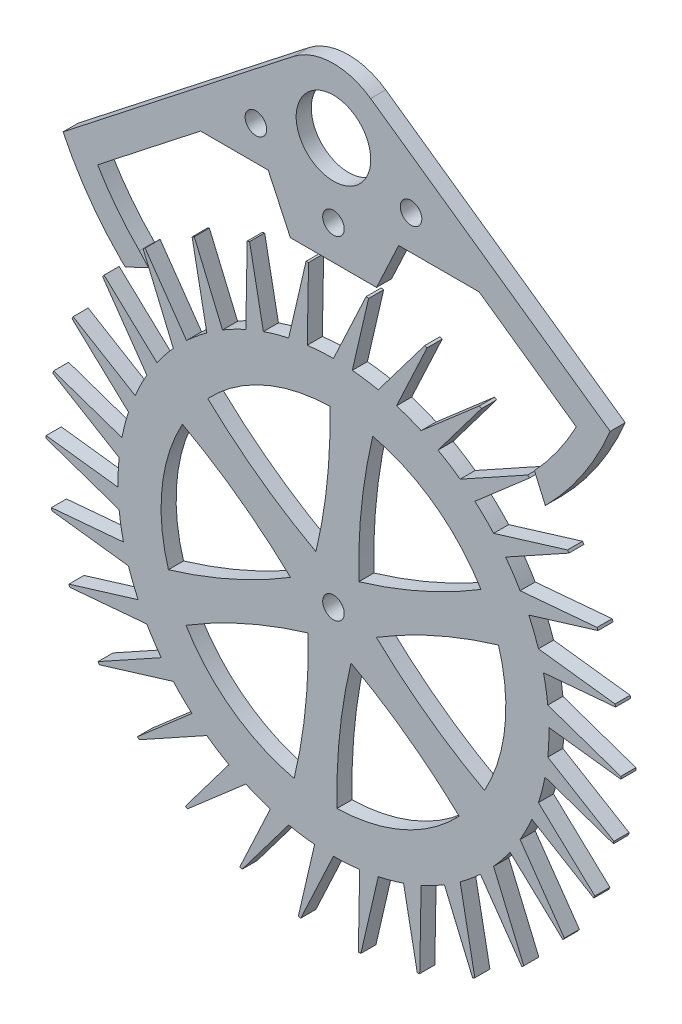
from build123d import *

# Parameters (mm, degrees)
BOSS_EXTRUDE1_OUTLINE_R   = 10.9855
BOSS_EXTRUDE1_DEPTH       = 4.445
BOSS_EXTRUDE1_2_OUTLINE_R = 3.175
BOSS_EXTRUDE1_2_DEPTH     = 4.445
BOSS_EXTRUDE2_START       = -4.445
BOSS_EXTRUDE2_DEPTH       = 4.445
SKETCH7_R                 = 3.175
CUT_EXTRUDE1_DEPTH        = 4.445


with BuildPart() as part:
    # Boss-Extrude1: read off the stored shape, not the designer's step
    # Boss-Extrude1 outline → Boss-Extrude1 (new body)
    with BuildSketch(Plane.XY):
        with BuildLine():
            Line((-54.458777735, 59.4313271), (-57.199913711, 62.422752094))
            ThreePointArc((-57.199913711, 62.422752094), (-63.837174983, 69.921714587), (-69.498019523, 78.182617369))
            Line((-69.498019523, 78.182617369), (-18.950687768, 117.793967198))
            ThreePointArc((-18.950687768, 117.793967198), (0.491450563, 100.692968803), (19.025663068, 118.774004609))
            Line((19.025663068, 118.774004609), (71.548814397, 81.822545135))
            ThreePointArc((71.548814397, 81.822545135), (65.954876705, 72.761477653), (59.220281874, 64.512822291))
            Line((59.220281874, 64.512822291), (62.422752094, 57.199913711))
            ThreePointArc((62.422752094, 57.199913711), (73.370097336, 70.499757218), (81.528932883, 85.670901133))
            Line((81.528932883, 85.670901133), (10.961308866, 135.317135851))
            ThreePointArc((10.961308866, 135.317135851), (-0.491450562, 138.780288286), (-11.750340751, 134.731027239))
            Line((-11.750340751, 134.731027239), (-79.66334696, 81.511089539))
            ThreePointArc((-79.66334696, 81.511089539), (-72.075468806, 68.623347712), (-62.422752094, 57.199913711))
            Line((-62.422752094, 57.199913711), (-61.330581123, 56.199123404))
            Line((-61.330581123, 56.199123404), (-54.458777735, 59.4313271))
        make_face()
        with Locations((0, 119.736628544)):
            Circle(BOSS_EXTRUDE1_OUTLINE_R, mode=Mode.SUBTRACT)
    extrude(amount=BOSS_EXTRUDE1_DEPTH)

    # Sketch6 → Boss-Extrude2 (add)
    with BuildSketch(Plane.XY.offset(4.445).offset(BOSS_EXTRUDE2_START)):
        with BuildLine():
            Line((-18.950687768, 117.793967198), (-39.160431049, 101.956628544))
            Line((-39.160431049, 101.956628544), (-19.214317984, 101.956628544))
            Line((-19.214317984, 101.956628544), (-12.7, 87.986628544))
            Line((-12.7, 87.986628544), (12.7, 87.986628544))
            Line((12.7, 87.986628544), (19.214317984, 101.956628544))
            Line((19.214317984, 101.956628544), (42.930039256, 101.956628544))
            Line((42.930039256, 101.956628544), (19.025663068, 118.774004609))
            ThreePointArc((19.025663068, 118.774004609), (0.491450563, 100.692968803), (-18.950687768, 117.793967198))
        make_face()
    extrude(amount=BOSS_EXTRUDE2_DEPTH)

    # Sketch7 → Cut-Extrude1 (cut)
    with BuildSketch(Plane.XY.offset(4.445)):
        with Locations((0, 98.146628544)):
            Circle(SKETCH7_R)
        with Locations((-22.86, 112.116628544)):
            Circle(SKETCH7_R)
        with Locations((22.86, 112.116628544)):
            Circle(SKETCH7_R)
    extrude(amount=-CUT_EXTRUDE1_DEPTH, mode=Mode.SUBTRACT)


with BuildPart() as body_2:
    # Boss-Extrude1 2 outline → Boss-Extrude1 2 (new body)
    with BuildSketch(Plane.XY):
        with BuildLine():
            ThreePointArc((0, 63.5), (-3.867036665, 63.382142812), (-7.719718745, 63.029008738))
            Line((-7.719718745, 63.029008738), (-7.336904313, 84.348087961))
            Line((-7.336904313, 84.348087961), (-8.07269153, 84.280850488))
            Line((-8.07269153, 84.280850488), (-13.202392367, 62.112372647))
            ThreePointArc((-13.202392367, 62.112372647), (-16.960421115, 61.193088789), (-20.655492146, 60.046653897))
            Line((-20.655492146, 60.046653897), (-24.713528935, 80.979451684))
            Line((-24.713528935, 80.979451684), (-25.41925798, 80.760704748))
            Line((-25.41925798, 80.760704748), (-25.827776835, 58.01013656))
            ThreePointArc((-25.827776835, 58.01013656), (-29.312553778, 56.32960315), (-32.688521424, 54.439972145))
            Line((-32.688521424, 54.439972145), (-41.010053755, 74.071624787))
            Line((-41.010053755, 74.071624787), (-41.654880881, 73.710928676))
            Line((-41.654880881, 73.710928676), (-37.324363521, 51.372579143))
            ThreePointArc((-37.324363521, 51.372579143), (-40.383587183, 49.004243553), (-43.292905459, 46.454002378))
            Line((-43.292905459, 46.454002378), (-55.514242438, 63.926512451))
            Line((-55.514242438, 63.926512451), (-56.069985606, 63.439631318))
            Line((-56.069985606, 63.439631318), (-47.189696418, 42.489793504))
            ThreePointArc((-47.189696418, 42.489793504), (-49.689664047, 39.537163365), (-52.005181783, 36.437769796))
            Line((-52.005181783, 36.437769796), (-67.592192339, 50.987504768))
            Line((-67.592192339, 50.987504768), (-68.034562905, 50.395717654))
            Line((-68.034562905, 50.395717654), (-54.99261314, 31.75))
            ThreePointArc((-54.99261314, 31.75), (-56.824064154, 28.342119417), (-58.444582115, 24.829031826))
            Line((-58.444582115, 24.829031826), (-76.716039091, 35.820098461))
            Line((-76.716039091, 35.820098461), (-77.02570334, 35.149269303))
            Line((-77.02570334, 35.149269303), (-60.392088785, 19.622579143))
            ThreePointArc((-60.392088785, 19.622579143), (-61.474979985, 15.90838885), (-62.32967376, 12.135146022))
            Line((-62.32967376, 12.135146022), (-82.487026811, 19.087181967))
            Line((-82.487026811, 19.087181967), (-82.650450929, 18.366629218))
            Line((-82.650450929, 18.366629218), (-63.152140356, 6.637557417))
            ThreePointArc((-63.152140356, 6.637557417), (-63.439144202, 2.779385353), (-63.490659571, -1.089103893))
            Line((-63.490659571, -1.089103893), (-84.652935643, 1.520064031))
            Line((-84.652935643, 1.520064031), (-84.662977211, 0.781279304))
            Line((-84.662977211, 0.781279304), (-63.152140356, -6.637557417))
            ThreePointArc((-63.152140356, -6.637557417), (-62.630713402, -10.47109062), (-61.876798896, -14.265754743))
            Line((-61.876798896, -14.265754743), (-83.119104977, -16.113487997))
            Line((-83.119104977, -16.113487997), (-82.975325131, -16.838216265))
            Line((-82.975325131, -16.838216265), (-60.392088785, -19.622579143))
            ThreePointArc((-60.392088785, -19.622579143), (-59.085019891, -23.263929688), (-57.558625192, -26.818923655))
            Line((-57.558625192, -26.818923655), (-77.952570574, -33.042803279))
            Line((-77.952570574, -33.042803279), (-77.661253183, -33.721800985))
            Line((-77.661253183, -33.721800985), (-54.99261314, -31.75))
            ThreePointArc((-54.99261314, -31.75), (-52.957027489, -35.040023395), (-50.72486337, -38.199976912))
            Line((-50.72486337, -38.199976912), (-69.379134778, -48.5279895))
            Line((-69.379134778, -48.5279895), (-68.953011811, -49.131581186))
            Line((-68.953011811, -49.131581186), (-47.189696418, -42.489793504))
            ThreePointArc((-47.189696418, -42.489793504), (-44.51455887, -45.28469994), (-41.674181614, -47.911507875))
            Line((-41.674181614, -47.911507875), (-57.773497876, -61.892269718))
            Line((-57.773497876, -61.892269718), (-57.231192949, -62.39407553))
            Line((-57.231192949, -62.39407553), (-37.324363521, -51.372579143))
            ThreePointArc((-37.324363521, -51.372579143), (-34.126590424, -53.550217796), (-30.802138146, -55.529076038))
            Line((-30.802138146, -55.529076038), (-43.642881887, -72.551560756))
            Line((-43.642881887, -72.551560756), (-43.00809633, -72.929649373))
            Line((-43.00809633, -72.929649373), (-25.827776835, -58.01013656))
            ThreePointArc((-25.827776835, -58.01013656), (-22.247126219, -59.475334173), (-18.583893437, -60.71975712))
            Line((-18.583893437, -60.71975712), (-27.604862539, -80.040000448))
            Line((-27.604862539, -80.040000448), (-26.905339525, -80.277847583))
            Line((-26.905339525, -80.277847583), (-13.202392367, -62.112372647))
            ThreePointArc((-13.202392367, -62.112372647), (-9.395355844, -62.801093052), (-5.553443409, -63.256693451))
            Line((-5.553443409, -63.256693451), (-10.360378235, -84.030308047))
            Line((-10.360378235, -84.030308047), (-9.626690277, -84.117518638))
            Line((-9.626690277, -84.117518638), (0, -63.5))
            ThreePointArc((0, -63.5), (3.867036665, -63.382142812), (7.719718745, -63.029008738))
            Line((7.719718745, -63.029008738), (7.336904313, -84.348087961))
            Line((7.336904313, -84.348087961), (8.07269153, -84.280850488))
            Line((8.07269153, -84.280850488), (13.202392367, -62.112372647))
            ThreePointArc((13.202392367, -62.112372647), (16.960421115, -61.193088789), (20.655492146, -60.046653897))
            Line((20.655492146, -60.046653897), (24.713528935, -80.979451684))
            Line((24.713528935, -80.979451684), (25.41925798, -80.760704748))
            Line((25.41925798, -80.760704748), (25.827776835, -58.01013656))
            ThreePointArc((25.827776835, -58.01013656), (29.312553778, -56.32960315), (32.688521424, -54.439972145))
            Line((32.688521424, -54.439972145), (41.010053755, -74.071624787))
            Line((41.010053755, -74.071624787), (41.654880881, -73.710928676))
            Line((41.654880881, -73.710928676), (37.324363521, -51.372579143))
            ThreePointArc((37.324363521, -51.372579143), (40.383587183, -49.004243553), (43.292905459, -46.454002378))
            Line((43.292905459, -46.454002378), (55.514242438, -63.926512451))
            Line((55.514242438, -63.926512451), (56.069985606, -63.439631318))
            Line((56.069985606, -63.439631318), (47.189696418, -42.489793504))
            ThreePointArc((47.189696418, -42.489793504), (49.689664047, -39.537163365), (52.005181783, -36.437769796))
            Line((52.005181783, -36.437769796), (67.592192339, -50.987504768))
            Line((67.592192339, -50.987504768), (68.034562905, -50.395717654))
            Line((68.034562905, -50.395717654), (54.99261314, -31.75))
            ThreePointArc((54.99261314, -31.75), (56.824064154, -28.342119417), (58.444582115, -24.829031826))
            Line((58.444582115, -24.829031826), (76.716039091, -35.820098461))
            Line((76.716039091, -35.820098461), (77.02570334, -35.149269303))
            Line((77.02570334, -35.149269303), (60.392088785, -19.622579143))
            ThreePointArc((60.392088785, -19.622579143), (61.474979985, -15.90838885), (62.32967376, -12.135146022))
            Line((62.32967376, -12.135146022), (82.487026811, -19.087181967))
            Line((82.487026811, -19.087181967), (82.650450929, -18.366629218))
            Line((82.650450929, -18.366629218), (63.152140356, -6.637557417))
            ThreePointArc((63.152140356, -6.637557417), (63.439144202, -2.779385353), (63.490659571, 1.089103893))
            Line((63.490659571, 1.089103893), (84.652935643, -1.520064031))
            Line((84.652935643, -1.520064031), (84.662977211, -0.781279304))
            Line((84.662977211, -0.781279304), (63.152140356, 6.637557417))
            ThreePointArc((63.152140356, 6.637557417), (62.630713402, 10.47109062), (61.876798896, 14.265754743))
            Line((61.876798896, 14.265754743), (83.119104977, 16.113487997))
            Line((83.119104977, 16.113487997), (82.975325131, 16.838216265))
            Line((82.975325131, 16.838216265), (60.392088785, 19.622579143))
            ThreePointArc((60.392088785, 19.622579143), (59.085019891, 23.263929688), (57.558625192, 26.818923655))
            Line((57.558625192, 26.818923655), (77.952570574, 33.042803279))
            Line((77.952570574, 33.042803279), (77.661253183, 33.721800985))
            Line((77.661253183, 33.721800985), (54.99261314, 31.75))
            ThreePointArc((54.99261314, 31.75), (52.957027489, 35.040023395), (50.72486337, 38.199976912))
            Line((50.72486337, 38.199976912), (69.379134778, 48.5279895))
            Line((69.379134778, 48.5279895), (68.953011811, 49.131581186))
            Line((68.953011811, 49.131581186), (47.189696418, 42.489793504))
            ThreePointArc((47.189696418, 42.489793504), (44.51455887, 45.28469994), (41.674181614, 47.911507875))
            Line((41.674181614, 47.911507875), (57.773497876, 61.892269718))
            Line((57.773497876, 61.892269718), (57.231192949, 62.39407553))
            Line((57.231192949, 62.39407553), (37.324363521, 51.372579143))
            ThreePointArc((37.324363521, 51.372579143), (34.126590424, 53.550217796), (30.802138146, 55.529076038))
            Line((30.802138146, 55.529076038), (43.642881887, 72.551560756))
            Line((43.642881887, 72.551560756), (43.00809633, 72.929649373))
            Line((43.00809633, 72.929649373), (25.827776835, 58.01013656))
            ThreePointArc((25.827776835, 58.01013656), (22.247126219, 59.475334173), (18.583893437, 60.71975712))
            Line((18.583893437, 60.71975712), (27.604862539, 80.040000448))
            Line((27.604862539, 80.040000448), (26.905339525, 80.277847583))
            Line((26.905339525, 80.277847583), (13.202392367, 62.112372647))
            ThreePointArc((13.202392367, 62.112372647), (9.395355844, 62.801093052), (5.553443409, 63.256693451))
            Line((5.553443409, 63.256693451), (10.360378235, 84.030308047))
            Line((10.360378235, 84.030308047), (9.626690277, 84.117518638))
            Line((9.626690277, 84.117518638), (0, 63.5))
        make_face()
        with BuildLine():
            ThreePointArc((-7.464872704, -10.274515829), (-8.261199499, -30.000859913), (-11.583611907, -49.461701701))
            ThreePointArc((-11.583611907, -49.461701701), (-29.859490816, -41.098063314), (-43.461340774, -26.301175983))
            ThreePointArc((-43.461340774, -26.301175983), (-25.979662276, -17.127643175), (-7.464872704, -10.274515829))
        make_face(mode=Mode.SUBTRACT)
        with BuildLine():
            ThreePointArc((5.165555367, -11.602027312), (21.850907071, -22.154838588), (37.043284234, -34.76255303))
            ThreePointArc((37.043284234, -34.76255303), (20.662221468, -46.408109248), (1.046816164, -50.789213185))
            ThreePointArc((1.046816164, -50.789213185), (1.843142958, -31.0628691), (5.165555367, -11.602027312))
        make_face(mode=Mode.SUBTRACT)
        with BuildLine():
            ThreePointArc((12.630428071, -1.327511483), (30.11210657, 7.846021325), (48.626896141, 14.699148671))
            ThreePointArc((48.626896141, 14.699148671), (50.521712285, -5.310045934), (44.508156938, -24.488037201))
            ThreePointArc((44.508156938, -24.488037201), (27.822805234, -13.935225925), (12.630428071, -1.327511483))
        make_face(mode=Mode.SUBTRACT)
        with BuildLine():
            ThreePointArc((-12.630428071, 1.327511483), (-30.11210657, -7.846021325), (-48.626896141, -14.699148671))
            ThreePointArc((-48.626896141, -14.699148671), (-50.521712285, 5.310045934), (-44.508156938, 24.488037201))
            ThreePointArc((-44.508156938, 24.488037201), (-27.822805234, 13.935225925), (-12.630428071, 1.327511483))
        make_face(mode=Mode.SUBTRACT)
        with BuildLine():
            ThreePointArc((-5.165555367, 11.602027312), (-21.850907071, 22.154838588), (-37.043284234, 34.76255303))
            ThreePointArc((-37.043284234, 34.76255303), (-20.662221468, 46.408109248), (-1.046816164, 50.789213185))
            ThreePointArc((-1.046816164, 50.789213185), (-1.843142958, 31.0628691), (-5.165555367, 11.602027312))
        make_face(mode=Mode.SUBTRACT)
        Circle(BOSS_EXTRUDE1_2_OUTLINE_R, mode=Mode.SUBTRACT)
        with BuildLine():
            ThreePointArc((11.583611907, 49.461701701), (29.859490816, 41.098063314), (43.461340774, 26.301175983))
            ThreePointArc((43.461340774, 26.301175983), (25.979662276, 17.127643175), (7.464872704, 10.274515829))
            ThreePointArc((7.464872704, 10.274515829), (8.261199499, 30.000859913), (11.583611907, 49.461701701))
        make_face(mode=Mode.SUBTRACT)
    extrude(amount=BOSS_EXTRUDE1_2_DEPTH)


solid = Compound([part.part, body_2.part])
